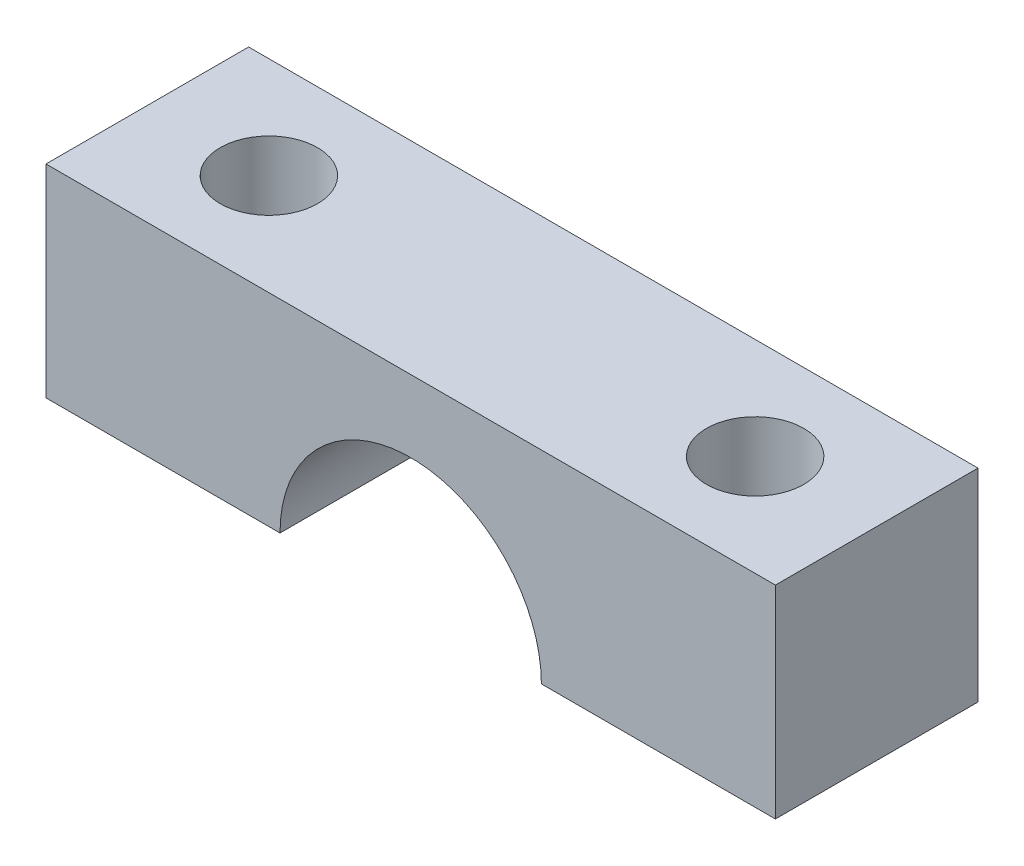
from build123d import *

# Parameters (mm, degrees)
BOSS_EXTRUDE1_DEPTH = 5
SKETCH2_R           = 1.2
CUT_EXTRUDE1_DEPTH  = 12.445523142


with BuildPart() as part:
    # Sketch1 → Boss-Extrude1 (new body)
    with BuildSketch(Plane.XY):
        with BuildLine():
            Line((3.225, 0), (9, 0))
            Line((9, 0), (9, 5))
            Line((9, 5), (-9, 5))
            Line((-9, 5), (-9, 0))
            Line((-9, 0), (-3.225, 0))
            ThreePointArc((-3.225, 0), (0, 3.225), (3.225, 0))
        make_face()
    extrude(amount=BOSS_EXTRUDE1_DEPTH)

    # Sketch2 → Cut-Extrude1 (cut, through all)
    with BuildSketch(Plane(origin=(0, 0, 0), x_dir=(1, 0, 0), z_dir=(0, 1, 0))):
        with Locations((-6, -2.5)):
            Circle(SKETCH2_R)
        with Locations((6, -2.5)):
            Circle(SKETCH2_R)
    extrude(amount=CUT_EXTRUDE1_DEPTH, mode=Mode.SUBTRACT)


solid = part.part
